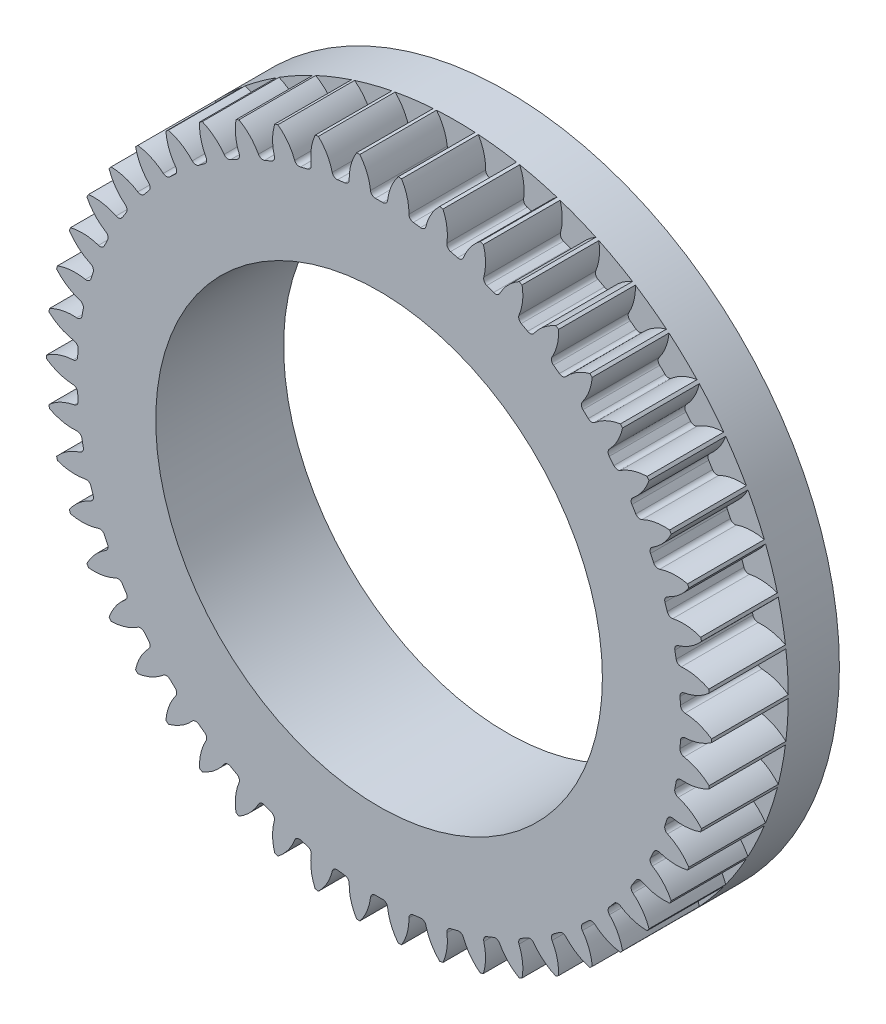
from build123d import *

# Parameters (mm, degrees)
SKETCH1_R                = 26
SKETCH1_R_2              = 17.465
BOSS_EXTRUDE1_DEPTH      = 10
CUT_EXTRUDE3_START       = -10
CUT_EXTRUDE3_DEPTH       = 49.105117767
FILLET1_R                = 0.38
CIRPATTERN1_COUNT        = 50
FILLET1_OF_CIRPATTERN1_R = 0.38
SKETCH1_8_R              = 26
SKETCH1_8_R_2            = 17.465
CUT_EXTRUDE4_DEPTH       = 4
SKETCH1_9_R              = 26
SKETCH1_9_R_2            = 17.465
BOSS_EXTRUDE2_DEPTH      = 4


with BuildPart() as part:
    # Sketch1 → Boss-Extrude1 (new body)
    with BuildSketch(Plane.XY):
        Circle(SKETCH1_R)
        Circle(SKETCH1_R_2, mode=Mode.SUBTRACT)
    extrude(amount=BOSS_EXTRUDE1_DEPTH)

    # Sketch2 → Cut-Extrude3 (cut)
    with BuildSketch(Plane.XY.offset(10).offset(CUT_EXTRUDE3_START)):
        with BuildLine():
            Line((80.813454696, 125.882981301), (1.504086556, 25.956458226))
            ThreePointArc((1.504086556, 25.956458226), (0.881704537, 24.843708327), (0.643214976, 23.591233001))
            ThreePointArc((0.643214976, 23.591233001), (0, 23.6), (-0.643214976, 23.591233001))
            ThreePointArc((-0.643214976, 23.591233001), (-0.881704537, 24.843708327), (-1.504086556, 25.956458226))
            Line((-1.504086556, 25.956458226), (-80.813454696, 125.882981301))
            Line((-80.813454696, 125.882981301), (-80.813454696, 381.032238707))
            Line((-80.813454696, 381.032238707), (80.813454696, 381.032238707))
            Line((80.813454696, 381.032238707), (80.813454696, 125.882981301))
        make_face()
    cut_extrude3 = extrude(amount=CUT_EXTRUDE3_DEPTH, mode=Mode.SUBTRACT)

    # Fillet1
    fillet1_edges = [part.edges().sort_by_distance(p)[0] for p in [
        (0.643214976, 23.591233001, 5),
        (-0.643214976, 23.591233001, 5),
    ]]
    fillet(fillet1_edges, radius=FILLET1_R)

    # CirPattern1: Cut-Extrude3 ×50 about axis
    cirpattern1_axis = Axis((0, 0, 10), (0, 0, 1))
    for i in range(1, CIRPATTERN1_COUNT):
        add(cut_extrude3.rotate(cirpattern1_axis, i * 360 / CIRPATTERN1_COUNT), mode=Mode.SUBTRACT)

    # Fillet1 of CirPattern1
    fillet1_of_cirpattern1_edges = [part.edges().sort_by_distance(p)[0] for p in [
        (-2.318622481, 23.485825295, 5),
        (-3.59490855, 23.324592869, 5),
        (-5.243893878, 23.010032095, 5),
        (-6.489908268, 22.690109975, 5),
        (-8.086465935, 22.171356943, 5),
        (-9.282558256, 21.697790492, 5),
        (-10.801509594, 20.983026247, 5),
        (-11.928816755, 20.363283891, 5),
        (-13.346206994, 19.463780693, 5),
        (-14.386950688, 18.707636139, 5),
        (-15.680426737, 17.63757969, 5),
        (-16.618193814, 16.756957789, 5),
        (-17.767356784, 15.53322352, 5),
        (-18.587358097, 14.542012205, 5),
        (-19.574085, 13.183899135, 5),
        (-20.263388639, 12.097730402, 5),
        (-21.072118203, 10.626656785, 5),
        (-21.619853437, 9.462660163, 5),
        (-22.237831514, 7.90182571, 5),
        (-22.635360232, 6.678358121, 5),
        (-23.052840938, 5.052378123, 5),
        (-23.293893873, 3.788734382, 5),
        (-23.504293289, 2.123251515, 5),
        (-23.585068894, 0.839360038, 5),
        (-23.585068894, -0.839360038, 5),
        (-23.504293289, -2.123251515, 5),
        (-23.293893873, -3.788734382, 5),
        (-23.052840938, -5.052378123, 5),
        (-22.635360232, -6.678358121, 5),
        (-22.237831514, -7.90182571, 5),
        (-21.619853437, -9.462660163, 5),
        (-21.072118203, -10.626656785, 5),
        (-20.263388639, -12.097730402, 5),
        (-19.574085, -13.183899135, 5),
        (-18.587358097, -14.542012205, 5),
        (-17.767356784, -15.53322352, 5),
        (-16.618193814, -16.756957789, 5),
        (-15.680426737, -17.63757969, 5),
        (-14.386950688, -18.707636139, 5),
        (-13.346206994, -19.463780693, 5),
        (-11.928816755, -20.363283891, 5),
        (-10.801509594, -20.983026247, 5),
        (-9.282558256, -21.697790492, 5),
        (-8.086465935, -22.171356943, 5),
        (-6.489908268, -22.690109975, 5),
        (-5.243893878, -23.010032095, 5),
        (-3.59490855, -23.324592869, 5),
        (-2.318622481, -23.485825295, 5),
        (-0.643214976, -23.591233001, 5),
        (0.643214976, -23.591233001, 5),
        (2.318622481, -23.485825295, 5),
        (3.59490855, -23.324592869, 5),
        (5.243893878, -23.010032095, 5),
        (6.489908268, -22.690109975, 5),
        (8.086465935, -22.171356943, 5),
        (9.282558256, -21.697790492, 5),
        (10.801509594, -20.983026247, 5),
        (11.928816755, -20.363283891, 5),
        (13.346206994, -19.463780693, 5),
        (14.386950688, -18.707636139, 5),
        (15.680426737, -17.63757969, 5),
        (16.618193814, -16.756957789, 5),
        (17.767356784, -15.53322352, 5),
        (18.587358097, -14.542012205, 5),
        (19.574085, -13.183899135, 5),
        (20.263388639, -12.097730402, 5),
        (21.072118203, -10.626656785, 5),
        (21.619853437, -9.462660163, 5),
        (22.237831514, -7.90182571, 5),
        (22.635360232, -6.678358121, 5),
        (23.052840938, -5.052378123, 5),
        (23.293893873, -3.788734382, 5),
        (23.504293289, -2.123251515, 5),
        (23.585068894, -0.839360038, 5),
        (23.585068894, 0.839360038, 5),
        (23.504293289, 2.123251515, 5),
        (23.293893873, 3.788734382, 5),
        (23.052840938, 5.052378123, 5),
        (22.635360232, 6.678358121, 5),
        (22.237831514, 7.90182571, 5),
        (21.619853437, 9.462660163, 5),
        (21.072118203, 10.626656785, 5),
        (20.263388639, 12.097730402, 5),
        (19.574085, 13.183899135, 5),
        (18.587358097, 14.542012205, 5),
        (17.767356784, 15.53322352, 5),
        (16.618193814, 16.756957789, 5),
        (15.680426737, 17.63757969, 5),
        (14.386950688, 18.707636139, 5),
        (13.346206994, 19.463780693, 5),
        (11.928816755, 20.363283891, 5),
        (10.801509594, 20.983026247, 5),
        (9.282558256, 21.697790492, 5),
        (8.086465935, 22.171356943, 5),
        (6.489908268, 22.690109975, 5),
        (5.243893878, 23.010032095, 5),
        (3.59490855, 23.324592869, 5),
        (2.318622481, 23.485825295, 5),
    ]]
    fillet(fillet1_of_cirpattern1_edges, radius=FILLET1_OF_CIRPATTERN1_R)

    # Sketch1<8> → Cut-Extrude4 (cut)
    with BuildSketch(Plane.XY):
        Circle(SKETCH1_8_R)
        Circle(SKETCH1_8_R_2, mode=Mode.SUBTRACT)
    extrude(amount=CUT_EXTRUDE4_DEPTH, mode=Mode.SUBTRACT)

    # Sketch1<9> → Boss-Extrude2 (add)
    with BuildSketch(Plane.XY):
        Circle(SKETCH1_9_R)
        Circle(SKETCH1_9_R_2, mode=Mode.SUBTRACT)
    extrude(amount=BOSS_EXTRUDE2_DEPTH)


solid = part.part
